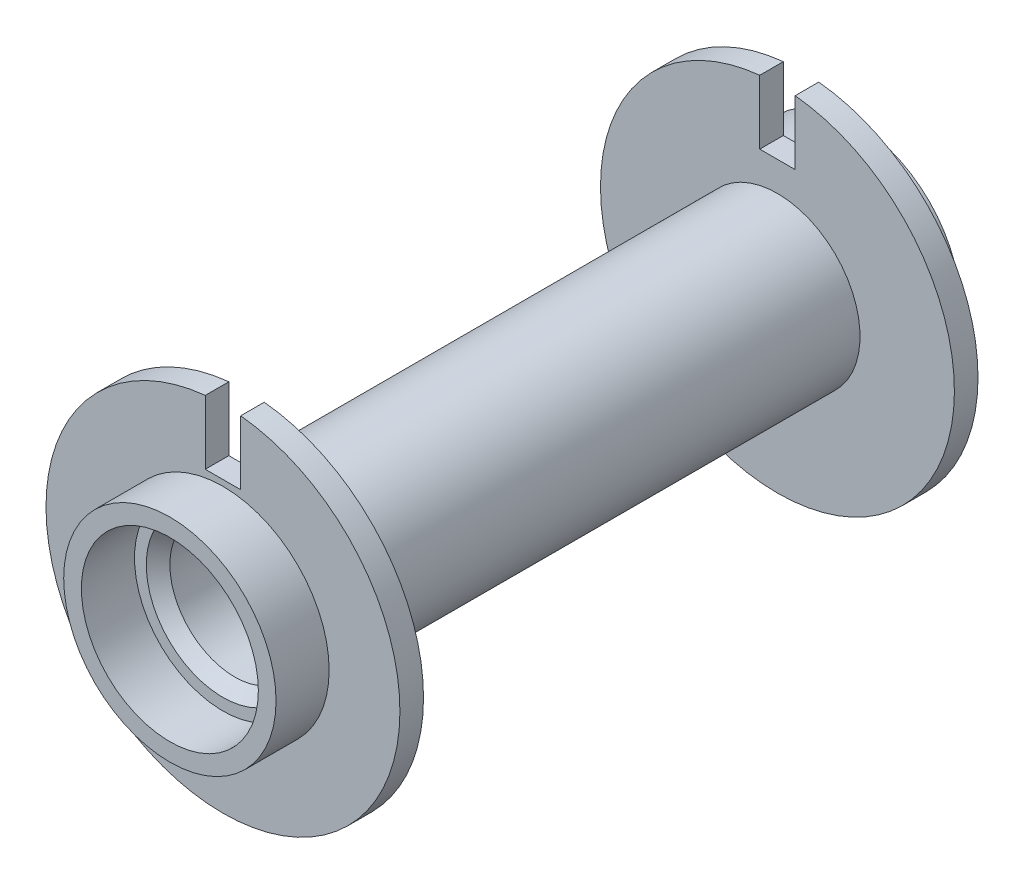
from build123d import *

# Parameters (mm, degrees)
SKETCH_1_R             = 7
SKETCH_1_R_2           = 5.5
EXTRUDE_1_DEPTH        = 29.5
EXTRUDE_START          = -7
SKETCH_2_R             = 15
SKETCH_2_R_2           = 5.5
EXTRUDE_2_DEPTH        = 7
SKETCH_5_W             = 5.5
SKETCH_5_H             = 9
CUT_EXTRUDE_4_DEPTH    = 15
HOLE_WIZARD_M3_1_D     = 2.5
HOLE_WIZARD_M3_1_DEPTH = 9.5
HOLE_WIZARD_M3_1_TIP   = 0.751075774
CHAMFER_1_SIZE         = 0.5
CHAMFER_2_SIZE         = 2
SKETCH1_R              = 7.5
EXTRUDE1_DEPTH         = 5
SKETCH2_W              = 25
SKETCH2_H              = 6
EXTRUDE2_DEPTH         = 5.5
CHAMFER2_SIZE          = 2
SKETCH4_R              = 17.5
EXTRUDE3_DEPTH         = 5.5
SKETCH5_R              = 17.5
EXTRUDE4_DEPTH         = 5.5
SKETCH6_R              = 9
SKETCH6_R_2            = 7.5
EXTRUDE5_DEPTH         = 5
SKETCH7_R              = 15
SKETCH7_R_2            = 5.5
EXTRUDE6_DEPTH         = 0.5
EXTRUDE7_START         = 0.5
SKETCH8_R              = 15
SKETCH8_R_2            = 5.5
EXTRUDE7_DEPTH         = 0.5
CHAMFER3_SIZE          = 1
EXTRUDE10_REACH        = 59.552
SKETCH11_W             = 3
SKETCH11_H             = 5.5


with BuildPart() as part:
    # 草图1 → 拉伸1 (new, symmetric)
    with BuildSketch(Plane.XY):
        Circle(SKETCH_1_R)
        Circle(SKETCH_1_R_2, mode=Mode.SUBTRACT)
    extrude(amount=EXTRUDE_1_DEPTH, both=True)

    # 草图2 → 拉伸2 (add)
    with BuildSketch(Plane.XY.offset(29.5).offset(EXTRUDE_START)):
        Circle(SKETCH_2_R)
        Circle(SKETCH_2_R_2, mode=Mode.SUBTRACT)
    extrude_2 = extrude(amount=EXTRUDE_2_DEPTH)

    # 镜向1: 拉伸2 across plane
    add(extrude_2.mirror(Plane.XY))

    # 草图5 → 拉伸4 (cut, symmetric)
    with BuildSketch(Plane(origin=(0, 0, 0), x_dir=(0, 0, -1), z_dir=(1, 0, 0))):
        with Locations((-26.75, -15.5)):
            Rectangle(SKETCH_5_W, SKETCH_5_H)
        with Locations((26.75, -15.5)):
            Rectangle(SKETCH_5_W, SKETCH_5_H)
    extrude(amount=CUT_EXTRUDE_4_DEPTH, both=True, mode=Mode.SUBTRACT)

    # M3 螺纹孔1
    with Locations(Plane(origin=(-8, -11, 27.5), x_dir=(0, 0, -1), z_dir=(0, -1, 0))):
        with Locations((0, 0), (0, 16), (55, 0), (55, 16)):
            Hole(HOLE_WIZARD_M3_1_D / 2, depth=HOLE_WIZARD_M3_1_DEPTH)
            with Locations((0, 0, -(HOLE_WIZARD_M3_1_DEPTH + HOLE_WIZARD_M3_1_TIP / 2))):  # 118° drill point
                Cone(0, HOLE_WIZARD_M3_1_D / 2, HOLE_WIZARD_M3_1_TIP, mode=Mode.SUBTRACT)

    # 倒角1
    chamfer_1_edges = [part.edges().sort_by_distance(p)[0] for p in [
        (8, -11, -28.75),
        (-8, -11, -28.75),
        (8, -11, 26.25),
        (-8, -11, 26.25),
    ]]
    chamfer(chamfer_1_edges, length=CHAMFER_1_SIZE)

    # 倒角2
    chamfer_2_edges = [part.edges().sort_by_distance(p)[0] for p in [
        (-5.5, 0, -29.5),
    ]]
    chamfer(chamfer_2_edges, length=CHAMFER_2_SIZE)

    # Sketch1 → Extrude1 (cut)
    with BuildSketch(Plane(origin=(0, 0, 29.5), x_dir=(-1, 0, 0), z_dir=(0, 0, -1))):
        Circle(SKETCH1_R)
    extrude(amount=EXTRUDE1_DEPTH, mode=Mode.SUBTRACT)

    # Sketch2 → Extrude2 (cut)
    with BuildSketch(Plane.XY.offset(-29.5)):
        with Locations((0, 12)):
            Rectangle(SKETCH2_W, SKETCH2_H)
    extrude(amount=EXTRUDE2_DEPTH, mode=Mode.SUBTRACT)

    # Chamfer2
    # the kernel refuses this chamfer: 2 mm, written as the material it takes off along each edge
    with BuildSketch(Plane(origin=(0, 0, 29.5), x_dir=(-1, 0, 0), z_dir=(0, -1, 0))) as chamfer2_piece_1:
        Polygon((7.5, CHAMFER2_SIZE), (7.5 + CHAMFER2_SIZE, 0), (7.5, 0), align=None)
    revolve(axis=Axis((0, 0, 29.5), (0, 0, -1)), mode=Mode.SUBTRACT)

    # Sketch4 → Extrude3 (cut)
    with BuildSketch(Plane.XY.offset(29.5)):
        Circle(SKETCH4_R)
    extrude(amount=-EXTRUDE3_DEPTH, mode=Mode.SUBTRACT)

    # Sketch5 → Extrude4 (cut)
    with BuildSketch(Plane(origin=(0, 0, -29.5), x_dir=(-1, 0, 0), z_dir=(0, 0, -1))):
        Circle(SKETCH5_R)
    extrude(amount=-EXTRUDE4_DEPTH, mode=Mode.SUBTRACT)

    # Sketch6 → Extrude5 (add)
    with BuildSketch(Plane.XY.offset(24)):
        with Locations(Location((0, 0, 0), (0, 0, 180))):
            Circle(SKETCH6_R)
        Circle(SKETCH6_R_2, mode=Mode.SUBTRACT)
    extrude5 = extrude(amount=EXTRUDE5_DEPTH)

    # Mirror1: Extrude5 across plane
    add(extrude5.mirror(Plane.XY))

    # Sketch7 → Extrude6 (add)
    with BuildSketch(Plane.XY.offset(24)):
        Circle(SKETCH7_R)
        Circle(SKETCH7_R_2, mode=Mode.SUBTRACT)
    extrude(amount=EXTRUDE6_DEPTH)

    # Sketch8 → Extrude7 (add)
    with BuildSketch(Plane(origin=(0, 0, -24), x_dir=(-1, 0, 0), z_dir=(0, 0, -1)).offset(EXTRUDE7_START)):
        Circle(SKETCH8_R)
        Circle(SKETCH8_R_2, mode=Mode.SUBTRACT)
    extrude(amount=-EXTRUDE7_DEPTH)

    # Chamfer3
    # the kernel refuses this chamfer: 1 mm, written as the material it takes off along each edge
    with BuildSketch(Plane(origin=(0, 0, 24.5), x_dir=(1, 0, 0), z_dir=(0, -1, 0))) as chamfer3_piece_1:
        Polygon((5.5, -CHAMFER3_SIZE), (5.5 + CHAMFER3_SIZE, 0), (5.5, 0), align=None)
    revolve(axis=Axis((0, 0, 24.5), (0, 0, 1)), mode=Mode.SUBTRACT)
    with BuildSketch(Plane(origin=(0, 0, -24.5), x_dir=(-1, 0, 0), z_dir=(0, -1, 0))) as chamfer3_piece_2:
        Polygon((5.5 + CHAMFER3_SIZE, 0), (5.5, -CHAMFER3_SIZE), (5.5, 0), align=None)
    revolve(axis=Axis((0, 0, -24.5), (0, 0, -1)), mode=Mode.SUBTRACT)

    # Extrude10: up to this face of the body (flat: up to its plane)
    extrude10_end = Plane(part.part.faces().sort_by_distance((14.575735931, 0, -24.5))[0])
    # Sketch11 → Extrude10 (cut, up to the picked face)
    with BuildSketch(Plane.XY.offset(24.5), mode=Mode.PRIVATE) as extrude10_sk1:
        with Locations((0, 12.25)):
            Rectangle(SKETCH11_W, SKETCH11_H)
    extrude10_tool1 = split(extrude(extrude10_sk1.sketch, amount=-EXTRUDE10_REACH, mode=Mode.PRIVATE), bisect_by=extrude10_end, keep=Keep.BOTH, mode=Mode.PRIVATE)
    add(extrude10_tool1.solids().sort_by(Axis((0, 12.25, 24.5), (0, 0, -1)))[0], mode=Mode.SUBTRACT)


solid = part.part
